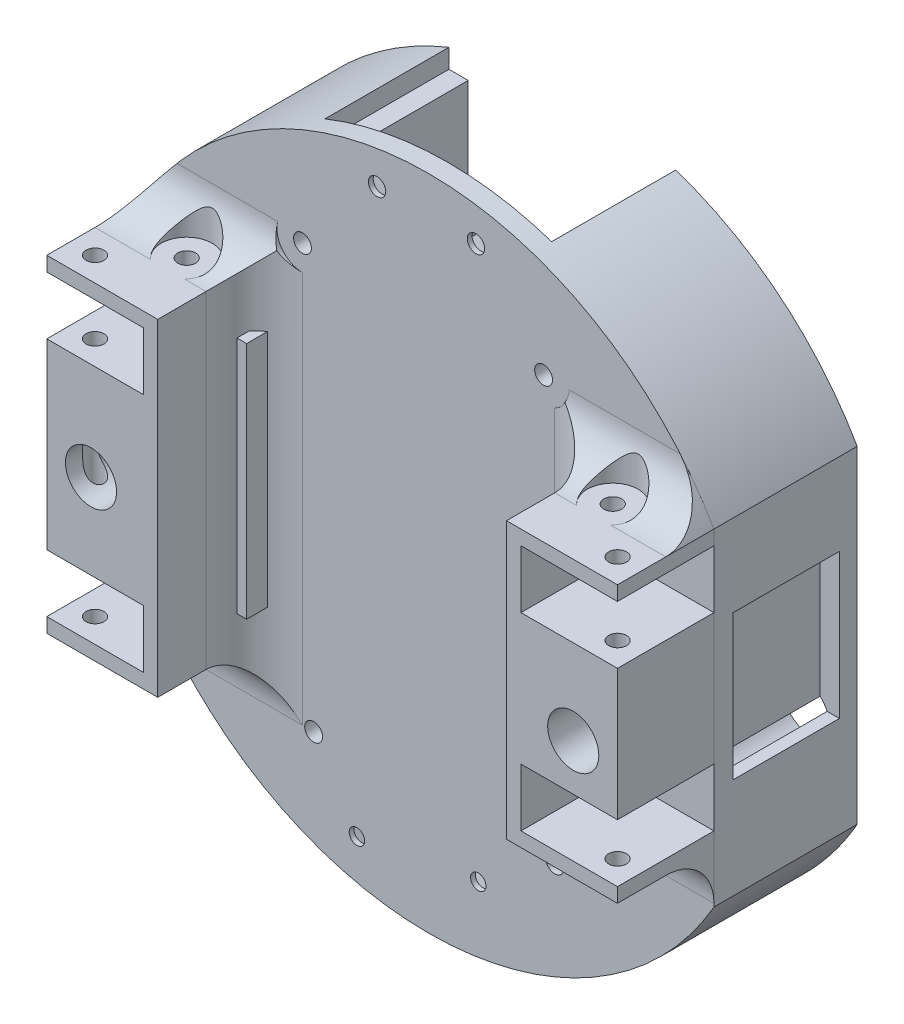
from build123d import *

# Parameters (mm, degrees)
SALIENTE_EXTRUIR2_DEPTH  = 25.7
CROQUIS3_R               = 68.187967498
SALIENTE_EXTRUIR3_DEPTH  = 4
CORTAR_EXTRUIR1_REACH    = 275.509
CROQUIS7_W               = 25
CROQUIS7_H               = 54.5
CORTAR_EXTRUIR2_DEPTH    = 2
CROQUIS8_R               = 1.6
CORTAR_EXTRUIR3_DEPTH    = 10
CROQUIS9_W               = 22
CROQUIS9_H               = 30
CORTAR_EXTRUIR4_DEPTH    = 4
CROQUIS10_R              = 1.85
CORTAR_EXTRUIR5_DEPTH    = 271.994192832
CROQUIS11_W              = 36.494454581
CROQUIS11_H              = 14.83840461
SALIENTE_EXTRUIR4_DEPTH  = 5
CROQUIS12_W              = 36.494454581
CROQUIS12_H              = 7.419202305
SALIENTE_EXTRUIR5_DEPTH  = 60
CROQUIS13_W              = 2.197225814
CROQUIS13_H              = 2.698054226
CORTAR_EXTRUIR6_DEPTH    = 288.011284081
CROQUIS15_W              = 2
CROQUIS15_H              = 49.489125547
SALIENTE_EXTRUIR6_DEPTH  = 6
CROQUIS16_R              = 1.6
CORTAR_EXTRUIR7_DEPTH    = 10
CROQUIS17_R              = 1.85
CORTAR_EXTRUIR8_DEPTH    = 167.163173861
CROQUIS23_W              = 25.422767162
CROQUIS23_H              = 18
CROQUIS23_W_2            = 26.870888419
SALIENTE_EXTRUIR8_DEPTH  = 20
CROQUIS24_W              = 20
CROQUIS24_H              = 12
CROQUIS24_W_2            = 2.422767162
CROQUIS24_H_2            = 18
CROQUIS24_W_3            = 3.870888419
CORTAR_EXTRUIR12_DEPTH   = 20
CROQUIS25_R              = 1.85
CORTAR_EXTRUIR13_DEPTH   = 157.420786096
CROQUIS26_R              = 7
CORTAR_EXTRUIR14_DEPTH   = 23
CORTAR_EXTRUIR15_DEPTH   = 3
CROQUIS28_W              = 15
CROQUIS28_H              = 9
CROQUIS28_W_2            = 18
CROQUIS28_H_2            = 16
CORTAR_EXTRUIR16_DEPTH   = 10
SALIENTE_EXTRUIR9_START  = -7.419202305
CROQUIS29_R              = 1.85
SALIENTE_EXTRUIR9_DEPTH  = 7.419202305
CROQUIS30_W              = 23
CROQUIS30_H              = 31.860199641
CROQUIS30_R              = 5.3
CROQUIS30_H_2            = 21.18941166
SALIENTE_EXTRUIR10_DEPTH = 20
CROQUIS31_R              = 1.85
CORTAR_EXTRUIR17_DEPTH   = 157.420786096
REDONDEO2_R              = 10
CROQUIS32_R              = 5.3
CORTAR_EXTRUIR18_DEPTH   = 278.093418476
CROQUIS33_R              = 5.3
CORTAR_EXTRUIR19_DEPTH   = 10
CORTAR_EXTRUIR21_START   = 10
CROQUIS35_R              = 5.3
CORTAR_EXTRUIR21_DEPTH   = 10
CROQUIS37_R              = 5.3
CORTAR_EXTRUIR23_DEPTH   = 10
CROQUIS38_W              = 4.954639541
CROQUIS38_H              = 9.52618695
SALIENTE_EXTRUIR11_DEPTH = 36.494454581
CROQUIS39_R              = 1.8
CORTAR_EXTRUIR24_DEPTH   = 276.972637799
CORTAR_EXTRUIR25_DEPTH   = 3
CROQUIS45_W              = 36.494454581
CROQUIS45_H              = 24.36459156
CORTAR_EXTRUIR26_DEPTH   = 278.093418476


with BuildPart() as part:
    # Croquis1 → Saliente-Extruir2 (new body)
    with BuildSketch(Plane.XY):
        with BuildLine():
            Line((-13.423815297, -132.294446721), (-13.423815297, -128.345307712))
            ThreePointArc((-13.423815297, -128.345307712), (-26.08823443, -248.103961959), (80.254008279, -191.589802718))
            ThreePointArc((80.254008279, -191.589802718), (67.366727513, -151.697034471), (33.576184703, -126.883445844))
            Line((33.576184703, -126.883445844), (33.576184703, -153.323488747))
            ThreePointArc((33.576184703, -153.323488747), (49.955618696, -169.422778516), (55.963615617, -191.589802718))
            ThreePointArc((55.963615617, -191.589802718), (49.955618696, -213.756826921), (33.576184703, -229.85611669))
            Line((33.576184703, -229.85611669), (33.576184703, -256.294446721))
            Line((33.576184703, -256.294446721), (-9.423815297, -256.294446721))
            Line((-9.423815297, -256.294446721), (-9.423815297, -229.867513756))
            ThreePointArc((-9.423815297, -229.867513756), (-31.831534056, -191.589802718), (-9.423815297, -153.312091681))
            Line((-9.423815297, -153.312091681), (-9.423815297, -132.294446721))
            Line((-9.423815297, -132.294446721), (-13.423815297, -132.294446721))
        make_face()
    extrude(amount=SALIENTE_EXTRUIR2_DEPTH)

    # Croquis3 → Saliente-Extruir3 (add)
    with BuildSketch(Plane.XY.offset(25.7)):
        with Locations(Location((12.066040781, -191.589802718, 0), (0, 0, 111.951246448))):
            Circle(CROQUIS3_R)
    extrude(amount=SALIENTE_EXTRUIR3_DEPTH)

    # Croquis6 → Cortar-Extruir1 (cut, up to next)
    with BuildSketch(Plane.XY.offset(29.7), mode=Mode.PRIVATE) as cortar_extruir1_sk1:
        with BuildLine():
            Line((-47.08078701, -225.519902539), (-47.08078701, -157.659702898))
            ThreePointArc((-47.08078701, -157.659702898), (-56.121926717, -191.589802718), (-47.08078701, -225.519902539))
        make_face()
    cortar_extruir1_tool1 = extrude(cortar_extruir1_sk1.sketch, amount=-CORTAR_EXTRUIR1_REACH, mode=Mode.PRIVATE) & part.part
    # Croquis6 → Cortar-Extruir1 (cut, up to next)
    with BuildSketch(Plane.XY.offset(29.7), mode=Mode.PRIVATE) as cortar_extruir1_sk2:
        with BuildLine():
            ThreePointArc((80.254008279, -191.589802718), (77.954965808, -174.032796418), (71.212868571, -157.659702898))
            Line((71.212868571, -157.659702898), (71.212868571, -225.519902539))
            ThreePointArc((71.212868571, -225.519902539), (77.954965808, -209.146809019), (80.254008279, -191.589802718))
        make_face()
    cortar_extruir1_tool2 = extrude(cortar_extruir1_sk2.sketch, amount=-CORTAR_EXTRUIR1_REACH, mode=Mode.PRIVATE) & part.part
    add(cortar_extruir1_tool1.solids().sort_by_distance((-50.718614, -191.589803, 29.7))[0], mode=Mode.SUBTRACT)
    add(cortar_extruir1_tool2.solids().sort_by_distance((74.850696, -191.589803, 29.7))[0], mode=Mode.SUBTRACT)

    # Croquis7 → Cortar-Extruir2 (cut)
    with BuildSketch(Plane.ZY.offset(47.08078701)):
        with Locations((15.2, -191.909702898)):
            Rectangle(CROQUIS7_W, CROQUIS7_H)
    extrude(amount=-CORTAR_EXTRUIR2_DEPTH, mode=Mode.SUBTRACT)

    # Croquis8 → Cortar-Extruir3 (cut)
    with BuildSketch(Plane.ZY.offset(45.08078701)):
        with Locations((5.7, -209.159702898)):
            Circle(CROQUIS8_R)
        with Locations((24.7, -174.959702898)):
            Circle(CROQUIS8_R)
    extrude(amount=-CORTAR_EXTRUIR3_DEPTH, mode=Mode.SUBTRACT)

    # Croquis9 → Cortar-Extruir4 (cut)
    with BuildSketch(Plane(origin=(71.212868571, 0, 0), x_dir=(0, 0, -1), z_dir=(1, 0, 0))):
        with Locations((-14.7, -189.659702898)):
            Rectangle(CROQUIS9_W, CROQUIS9_H)
    extrude(amount=-CORTAR_EXTRUIR4_DEPTH, mode=Mode.SUBTRACT)

    # Croquis10 → Cortar-Extruir5 (cut, through all)
    with BuildSketch(Plane(origin=(0, 0, 0), x_dir=(-1, 0, 0), z_dir=(0, 0, -1))):
        with Locations((11.768253413, -235.543487664)):
            Circle(CROQUIS10_R)
        with Locations((-38.213901437, -234.207749444)):
            Circle(CROQUIS10_R)
        with Locations((37.916114069, -192.925540938)):
            Circle(CROQUIS10_R)
        with Locations((-62.048195631, -190.254064499)):
            Circle(CROQUIS10_R)
        with Locations((-35.900334975, -147.636117773)):
            Circle(CROQUIS10_R)
        with Locations((14.081819875, -148.971855993)):
            Circle(CROQUIS10_R)
    extrude(amount=-CORTAR_EXTRUIR5_DEPTH, mode=Mode.SUBTRACT)

    # Croquis11 → Saliente-Extruir4 (add)
    with BuildSketch(Plane.XY.offset(29.7)):
        with Locations((11.63234752, -143.283831758)):
            Rectangle(CROQUIS11_W, CROQUIS11_H)
    extrude(amount=SALIENTE_EXTRUIR4_DEPTH)

    # Croquis12 → Saliente-Extruir5 (add)
    with BuildSketch(Plane.XY.offset(34.7)):
        with Locations((11.63234752, -139.574230606)):
            Rectangle(CROQUIS12_W, CROQUIS12_H)
    extrude(amount=SALIENTE_EXTRUIR5_DEPTH)

    # Croquis13 → Cortar-Extruir6 (cut, through all)
    with BuildSketch(Plane(origin=(29.879574811, 0, 0), x_dir=(0, 0, -1), z_dir=(1, 0, 0))):
        with Locations((-66.794067754, -141.934804645)):
            Rectangle(CROQUIS13_W, CROQUIS13_H)
    extrude(amount=-CORTAR_EXTRUIR6_DEPTH, mode=Mode.SUBTRACT)

    # Croquis15 → Saliente-Extruir6 (add)
    with BuildSketch(Plane.XY.offset(29.7)):
        with Locations((-20.658019848, -191.540467922)):
            Rectangle(CROQUIS15_W, CROQUIS15_H)
        with Locations((43.341980152, -191.540467922)):
            Rectangle(CROQUIS15_W, CROQUIS15_H)
    extrude(amount=SALIENTE_EXTRUIR6_DEPTH)

    # Croquis16 → Cortar-Extruir7 (cut)
    with BuildSketch(Plane.XY.offset(29.7)):
        with Locations((-2.795177489, -249.862416258)):
            Circle(CROQUIS16_R)
        with Locations((22.369152578, -245.40207204)):
            Circle(CROQUIS16_R)
    extrude(amount=-CORTAR_EXTRUIR7_DEPTH, mode=Mode.SUBTRACT)

    # Croquis17 → Cortar-Extruir8 (cut, through all)
    with BuildSketch(Plane(origin=(0, -143.283831758, 0), x_dir=(-1, 0, 0), z_dir=(0, -1, 0))):
        with Locations(Location((0.577969088, -88.2, 0), (0, 0, 90))):
            Circle(CROQUIS17_R)
        with Locations(Location((-10.071096588, -88.2, 0), (0, 0, 90))):
            Circle(CROQUIS17_R)
        with Locations(Location((-21.422030912, -88.2, 0), (0, 0, 90))):
            Circle(CROQUIS17_R)
    extrude(amount=-CORTAR_EXTRUIR8_DEPTH, mode=Mode.SUBTRACT)

    # Croquis23 → Saliente-Extruir8 (add)
    with BuildSketch(Plane.XY.offset(29.7)):
        with Locations((-34.369403429, -166.659702898)):
            Rectangle(CROQUIS23_W, CROQUIS23_H)
        with Locations((-34.369403429, -216.519902539)):
            Rectangle(CROQUIS23_W, CROQUIS23_H)
        with Locations((57.777424362, -166.659702898)):
            Rectangle(CROQUIS23_W_2, CROQUIS23_H)
        with Locations((57.777424362, -205.849114558)):
            Rectangle(CROQUIS23_W_2, CROQUIS23_H)
    extrude(amount=SALIENTE_EXTRUIR8_DEPTH)

    # Croquis24 → Cortar-Extruir12 (cut)
    with BuildSketch(Plane.XY.offset(49.7)):
        with Locations((-37.08078701, -166.659702898)):
            Rectangle(CROQUIS24_W, CROQUIS24_H)
        with Locations((-37.08078701, -216.519902539)):
            Rectangle(CROQUIS24_W, CROQUIS24_H)
        with Locations((61.212868571, -166.659702898)):
            Rectangle(CROQUIS24_W, CROQUIS24_H)
        with Locations((61.212868571, -205.849114558)):
            Rectangle(CROQUIS24_W, CROQUIS24_H)
        with Locations((-22.869403429, -166.659702898)):
            Rectangle(CROQUIS24_W_2, CROQUIS24_H_2)
        with Locations((-22.869403429, -216.519902539)):
            Rectangle(CROQUIS24_W_2, CROQUIS24_H_2)
        with Locations((46.277424362, -166.659702898)):
            Rectangle(CROQUIS24_W_3, CROQUIS24_H_2)
        with Locations((46.277424362, -205.849114558)):
            Rectangle(CROQUIS24_W_3, CROQUIS24_H_2)
    extrude(amount=-CORTAR_EXTRUIR12_DEPTH, mode=Mode.SUBTRACT)

    # Croquis25 → Cortar-Extruir13 (cut, through all)
    with BuildSketch(Plane(origin=(0, -157.659702898, 0), x_dir=(1, 0, 0), z_dir=(0, 1, 0))):
        with Locations(Location((-42.08078701, -44.7, 0), (0, 0, 270))):
            Circle(CROQUIS25_R)
        with Locations(Location((-32.08078701, -35.7, 0), (0, 0, 270))):
            Circle(CROQUIS25_R)
        with Locations(Location((66.233156416, -44.7, 0), (0, 0, 270))):
            Circle(CROQUIS25_R)
        with Locations(Location((56.233156416, -35.7, 0), (0, 0, 270))):
            Circle(CROQUIS25_R)
    extrude(amount=-CORTAR_EXTRUIR13_DEPTH, mode=Mode.SUBTRACT)

    # Croquis26 → Cortar-Extruir14 (cut)
    with BuildSketch(Plane(origin=(0, 0, 0), x_dir=(-1, 0, 0), z_dir=(0, 0, -1))):
        with Locations((34.679916564, -216.470406453)):
            Circle(CROQUIS26_R)
        with Locations((34.679916564, -167.641891075)):
            Circle(CROQUIS26_R)
        with Locations(Location((-58.811998126, -167.641891075, 0), (0, 0, 180))):
            Circle(CROQUIS26_R)
        with Locations(Location((-62.399975323, -207.748824541, 0), (0, 0, 133.436969184))):
            Circle(CROQUIS26_R)
    extrude(amount=-CORTAR_EXTRUIR14_DEPTH, mode=Mode.SUBTRACT)

    # Croquis27 → Cortar-Extruir15 (cut)
    with BuildSketch(Plane(origin=(0, 0, 25.7), x_dir=(-1, 0, 0), z_dir=(0, 0, -1))):
        Polygon((-25.714624157, -247.869422828), (-21.905099905, -249.53301081), (-18.559628325, -247.065660022), (-19.023680998, -242.934721252), (-22.83320525, -241.271133271), (-26.17867683, -243.738484058), align=None)
        Polygon((0.321506024, -253.203216983), (4.451560053, -253.67507895), (6.925231518, -250.334278225), (5.268848954, -246.521615533), (1.138794925, -246.049753566), (-1.33487654, -249.390554291), align=None)
    extrude(amount=-CORTAR_EXTRUIR15_DEPTH, mode=Mode.SUBTRACT)

    # Croquis28 → Cortar-Extruir16 (cut)
    with BuildSketch(Plane(origin=(0, -135.864629453, 0), x_dir=(1, 0, 0), z_dir=(0, 1, 0))):
        with Locations((11.379574811, -78.7)):
            Rectangle(CROQUIS28_W, CROQUIS28_H)
        with Locations((12.879574811, -55.7)):
            Rectangle(CROQUIS28_W_2, CROQUIS28_H_2)
    extrude(amount=-CORTAR_EXTRUIR16_DEPTH, mode=Mode.SUBTRACT)

    # Croquis29 → Saliente-Extruir9 (add)
    with BuildSketch(Plane(origin=(0, -135.864629453, 0), x_dir=(1, 0, 0), z_dir=(0, 1, 0)).offset(SALIENTE_EXTRUIR9_START)):
        with Locations((10.071096588, -88.2)):
            Circle(CROQUIS29_R)
    extrude(amount=SALIENTE_EXTRUIR9_DEPTH)

    # Croquis30 → Saliente-Extruir10 (add)
    # profile 1 of 2: a face of its own
    with BuildSketch(Plane.XY.offset(29.7)):
        with Locations((-35.58078701, -191.589802719)):
            Rectangle(CROQUIS30_W, CROQUIS30_H)
        with Locations((-37.916114069, -192.925540938)):
            Circle(CROQUIS30_R, mode=Mode.SUBTRACT)
    # profile 2 of 2: a face of its own
    with BuildSketch(Plane.XY.offset(29.7)):
        with Locations((59.712868571, -186.254408728)):
            Rectangle(CROQUIS30_W, CROQUIS30_H_2)
        with Locations((62.048195631, -190.254064499)):
            Circle(CROQUIS30_R, mode=Mode.SUBTRACT)
    extrude(amount=SALIENTE_EXTRUIR10_DEPTH)

    # Croquis31 → Cortar-Extruir17 (cut, through all)
    with BuildSketch(Plane.XZ.offset(225.519902539)):
        with Locations(Location((-42.08078701, 44.7, 0), (0, 0, 90))):
            Circle(CROQUIS31_R)
        with Locations(Location((-32.08078701, 35.7, 0), (0, 0, 90))):
            Circle(CROQUIS31_R)
        with Locations(Location((56.233156416, 35.7, 0), (0, 0, 90))):
            Circle(CROQUIS31_R)
        with Locations(Location((66.233156416, 44.7, 0), (0, 0, 90))):
            Circle(CROQUIS31_R)
    extrude(amount=-CORTAR_EXTRUIR17_DEPTH, mode=Mode.SUBTRACT)

    # Redondeo2
    # the kernel refuses this fillet: 10 mm, written as the material it adds along each edge
    with BuildSketch(Plane(origin=(-47.08078701, -225.519902539, 29.7), x_dir=(0, -1, 0), z_dir=(1, 0, 0))) as redondeo2_piece_1_section:
        with BuildLine():
            CenterArc((REDONDEO2_R, -REDONDEO2_R), REDONDEO2_R, 90, 90)
            Line((0, -REDONDEO2_R), (0, 0))
            Line((0, 0), (REDONDEO2_R, 0))
        make_face()
    redondeo2_piece_1 = extrude(amount=23, mode=Mode.PRIVATE)
    redondeo2_piece_1 = redondeo2_piece_1 & Plane(origin=(12.066040781, -191.589802718, 31.973355748), x_dir=(-0.3738175078844624, 0.9275022753605783, 0), z_dir=(0, 0, -1)) * Cylinder(68.187967498, 86, mode=Mode.PRIVATE)
    redondeo2_piece_1 = redondeo2_piece_1 - Plane(origin=(-32.08078701, -227.679625959, 35.7), x_dir=(0, 0, 1), z_dir=(0, 1, 0)) * Cylinder(1.85, 86, mode=Mode.PRIVATE)
    add(redondeo2_piece_1)
    with BuildSketch(Plane(origin=(71.212868571, -157.659702898, 29.7), x_dir=(0, 1, 0), z_dir=(-1, 0, 0))) as redondeo2_piece_2_section:
        with BuildLine():
            CenterArc((REDONDEO2_R, -REDONDEO2_R), REDONDEO2_R, 90, 90)
            Line((0, -REDONDEO2_R), (0, 0))
            Line((0, 0), (REDONDEO2_R, 0))
        make_face()
    redondeo2_piece_2 = extrude(amount=23, mode=Mode.PRIVATE)
    redondeo2_piece_2 = redondeo2_piece_2 & Plane(origin=(12.066040781, -191.589802718, 31.973351105), x_dir=(-0.3738175078844624, 0.9275022753605783, 0), z_dir=(0, 0, -1)) * Cylinder(68.187967498, 87, mode=Mode.PRIVATE)
    redondeo2_piece_2 = redondeo2_piece_2 - Plane(origin=(56.233156416, -155.49997883, 35.7), x_dir=(0, 0, 1), z_dir=(0, 1, 0)) * Cylinder(1.85, 87, mode=Mode.PRIVATE)
    add(redondeo2_piece_2)
    with BuildSketch(Plane(origin=(71.212868571, -214.849114558, 29.7), x_dir=(0, -1, 0), z_dir=(-1, 0, 0))) as redondeo2_piece_3_section:
        with BuildLine():
            CenterArc((REDONDEO2_R, REDONDEO2_R), REDONDEO2_R, 180, 90)
            Line((0, REDONDEO2_R), (0, 0))
            Line((0, 0), (REDONDEO2_R, 0))
        make_face()
    redondeo2_piece_3 = extrude(amount=23, mode=Mode.PRIVATE)
    redondeo2_piece_3 = redondeo2_piece_3 - Plane(origin=(56.233156416, -217.15062126, 35.7), x_dir=(0, 0, 1), z_dir=(0, 1, 0)) * Cylinder(1.85, 87, mode=Mode.PRIVATE)
    add(redondeo2_piece_3)
    with BuildSketch(Plane(origin=(-47.08078701, -157.659702898, 29.7), x_dir=(0, 1, 0), z_dir=(1, 0, 0))) as redondeo2_piece_4_section:
        with BuildLine():
            CenterArc((REDONDEO2_R, REDONDEO2_R), REDONDEO2_R, 180, 90)
            Line((0, REDONDEO2_R), (0, 0))
            Line((0, 0), (REDONDEO2_R, 0))
        make_face()
    redondeo2_piece_4 = extrude(amount=23, mode=Mode.PRIVATE)
    redondeo2_piece_4 = redondeo2_piece_4 & Plane(origin=(12.066040781, -191.589802718, 31.973356861), x_dir=(-0.3738175078844624, 0.9275022753605783, 0), z_dir=(0, 0, -1)) * Cylinder(68.187967498, 86, mode=Mode.PRIVATE)
    redondeo2_piece_4 = redondeo2_piece_4 - Plane(origin=(-32.08078701, -155.49997901, 35.7), x_dir=(0, 0, 1), z_dir=(0, 1, 0)) * Cylinder(1.85, 86, mode=Mode.PRIVATE)
    add(redondeo2_piece_4)
    with BuildSketch(Plane(origin=(-24.08078701, -157.659702898, 29.7), x_dir=(1, 0, 0), z_dir=(0, -1, 0))) as redondeo2_piece_5:
        with BuildLine():
            CenterArc((REDONDEO2_R, REDONDEO2_R), REDONDEO2_R, 180, 90)
            Line((0, REDONDEO2_R), (0, 0))
            Line((0, 0), (REDONDEO2_R, 0))
        make_face()
    extrude(amount=67.86019964)
    with BuildSketch(Plane(origin=(48.212868571, -214.849114558, 29.7), x_dir=(-1, 0, 0), z_dir=(0, 1, 0))) as redondeo2_piece_6:
        with BuildLine():
            CenterArc((REDONDEO2_R, REDONDEO2_R), REDONDEO2_R, 180, 90)
            Line((0, REDONDEO2_R), (0, 0))
            Line((0, 0), (REDONDEO2_R, 0))
        make_face()
    extrude(amount=57.18941166)
    with BuildSketch(Plane(origin=(-24.08078701, -157.659702898, 29.7), x_dir=(1, 0, 0), z_dir=(0, -1, 0))) as redondeo2_piece_7a_section:
        with BuildLine():
            CenterArc((REDONDEO2_R, REDONDEO2_R), REDONDEO2_R, 180, 90)
            Line((0, REDONDEO2_R), (0, 0))
            Line((0, 0), (REDONDEO2_R, 0))
        make_face()
    redondeo2_piece_7a = extrude(amount=92.86019964, mode=Mode.PRIVATE)
    redondeo2_piece_7a = redondeo2_piece_7a & Plane(origin=(12.066040781, -191.589802718, 31.940610005), x_dir=(-0.3738175078844624, 0.9275022753605783, 0), z_dir=(0, 0, -1)) * Cylinder(68.187967498, 226, mode=Mode.PRIVATE)
    redondeo2_piece_7a = split(redondeo2_piece_7a, bisect_by=Plane(origin=(-21.788201619, -225.519902539, 31.940610005), z_dir=(0, -1, 0)), keep=Keep.TOP, mode=Mode.PRIVATE)
    with BuildSketch(Plane(origin=(-47.08078701, -225.519902539, 29.7), x_dir=(0, -1, 0), z_dir=(1, 0, 0))) as redondeo2_piece_7b_section:
        with BuildLine():
            CenterArc((REDONDEO2_R, -REDONDEO2_R), REDONDEO2_R, 90, 90)
            Line((0, -REDONDEO2_R), (0, 0))
            Line((0, 0), (REDONDEO2_R, 0))
        make_face()
    redondeo2_piece_7b = extrude(amount=48, mode=Mode.PRIVATE)
    redondeo2_piece_7b = redondeo2_piece_7b - Plane(origin=(-11.768253413, -235.543487664, 31.968653501), x_dir=(-1, 0, 0), z_dir=(0, 0, -1)) * Cylinder(1.85, 136, mode=Mode.PRIVATE)
    redondeo2_piece_7b = split(redondeo2_piece_7b, bisect_by=Plane(origin=(-24.08078701, -227.77002234, 31.968653501), z_dir=(1, 0, 0)), keep=Keep.TOP, mode=Mode.PRIVATE)
    redondeo2_piece_7 = redondeo2_piece_7a & redondeo2_piece_7b
    add(redondeo2_piece_7)
    with BuildSketch(Plane(origin=(71.212868571, -157.659702898, 29.7), x_dir=(0, 1, 0), z_dir=(-1, 0, 0))) as redondeo2_piece_8a_section:
        with BuildLine():
            CenterArc((REDONDEO2_R, -REDONDEO2_R), REDONDEO2_R, 90, 90)
            Line((0, -REDONDEO2_R), (0, 0))
            Line((0, 0), (REDONDEO2_R, 0))
        make_face()
    redondeo2_piece_8a = extrude(amount=48, mode=Mode.PRIVATE)
    redondeo2_piece_8a = redondeo2_piece_8a - Plane(origin=(35.900334975, -147.636117773, 31.968653501), x_dir=(-1, 0, 0), z_dir=(0, 0, -1)) * Cylinder(1.85, 137, mode=Mode.PRIVATE)
    redondeo2_piece_8a = split(redondeo2_piece_8a, bisect_by=Plane(origin=(48.212868571, -155.409583097, 31.968653501), z_dir=(-1, 0, 0)), keep=Keep.TOP, mode=Mode.PRIVATE)
    with BuildSketch(Plane(origin=(48.212868571, -214.849114558, 29.7), x_dir=(-1, 0, 0), z_dir=(0, 1, 0))) as redondeo2_piece_8b_section:
        with BuildLine():
            CenterArc((REDONDEO2_R, REDONDEO2_R), REDONDEO2_R, 180, 90)
            Line((0, REDONDEO2_R), (0, 0))
            Line((0, 0), (REDONDEO2_R, 0))
        make_face()
    redondeo2_piece_8b = extrude(amount=82.18941166, mode=Mode.PRIVATE)
    redondeo2_piece_8b = redondeo2_piece_8b & Plane(origin=(12.066040781, -191.589802718, 31.940610005), x_dir=(-0.3738175078844624, 0.9275022753605783, 0), z_dir=(0, 0, -1)) * Cylinder(68.187967498, 205, mode=Mode.PRIVATE)
    redondeo2_piece_8b = split(redondeo2_piece_8b, bisect_by=Plane(origin=(45.920283181, -157.659702898, 31.940610005), z_dir=(0, 1, 0)), keep=Keep.TOP, mode=Mode.PRIVATE)
    redondeo2_piece_8 = redondeo2_piece_8a & redondeo2_piece_8b
    add(redondeo2_piece_8)
    with BuildSketch(Plane(origin=(71.212868571, -214.849114558, 29.7), x_dir=(0, -1, 0), z_dir=(-1, 0, 0))) as redondeo2_piece_9a_section:
        with BuildLine():
            CenterArc((REDONDEO2_R, REDONDEO2_R), REDONDEO2_R, 180, 90)
            Line((0, REDONDEO2_R), (0, 0))
            Line((0, 0), (REDONDEO2_R, 0))
        make_face()
    redondeo2_piece_9a = extrude(amount=48, mode=Mode.PRIVATE)
    redondeo2_piece_9a = split(redondeo2_piece_9a, bisect_by=Plane(origin=(48.212868571, -217.113065701, 31.963951143), z_dir=(-1, 0, 0)), keep=Keep.TOP, mode=Mode.PRIVATE)
    with BuildSketch(Plane(origin=(48.212868571, -239.849114558, 29.7), x_dir=(-1, 0, 0), z_dir=(0, 1, 0))) as redondeo2_piece_9b_section:
        with BuildLine():
            CenterArc((REDONDEO2_R, REDONDEO2_R), REDONDEO2_R, 180, 90)
            Line((0, REDONDEO2_R), (0, 0))
            Line((0, 0), (REDONDEO2_R, 0))
        make_face()
    redondeo2_piece_9b = extrude(amount=82.18941166, mode=Mode.PRIVATE)
    redondeo2_piece_9b = redondeo2_piece_9b - Plane(origin=(38.213901437, -234.207749444, 31.968757172), x_dir=(-1, 0, 0), z_dir=(0, 0, -1)) * Cylinder(1.85, 205, mode=Mode.PRIVATE)
    redondeo2_piece_9b = split(redondeo2_piece_9b, bisect_by=Plane(origin=(45.963029378, -214.849114558, 31.968757172), z_dir=(0, -1, 0)), keep=Keep.TOP, mode=Mode.PRIVATE)
    redondeo2_piece_9 = redondeo2_piece_9a & redondeo2_piece_9b
    add(redondeo2_piece_9)
    with BuildSketch(Plane(origin=(-47.08078701, -157.659702898, 29.7), x_dir=(0, 1, 0), z_dir=(1, 0, 0))) as redondeo2_piece_10a_section:
        with BuildLine():
            CenterArc((REDONDEO2_R, REDONDEO2_R), REDONDEO2_R, 180, 90)
            Line((0, REDONDEO2_R), (0, 0))
            Line((0, 0), (REDONDEO2_R, 0))
        make_face()
    redondeo2_piece_10a = extrude(amount=48, mode=Mode.PRIVATE)
    redondeo2_piece_10a = redondeo2_piece_10a - Plane(origin=(-14.081819875, -148.971855993, 31.97595745), x_dir=(-1, 0, 0), z_dir=(0, 0, -1)) * Cylinder(1.85, 136, mode=Mode.PRIVATE)
    redondeo2_piece_10a = split(redondeo2_piece_10a, bisect_by=Plane(origin=(-24.08078701, -155.427355558, 31.97595745), z_dir=(1, 0, 0)), keep=Keep.TOP, mode=Mode.PRIVATE)
    with BuildSketch(Plane(origin=(-24.08078701, -132.659702898, 29.7), x_dir=(1, 0, 0), z_dir=(0, -1, 0))) as redondeo2_piece_10b_section:
        with BuildLine():
            CenterArc((REDONDEO2_R, REDONDEO2_R), REDONDEO2_R, 180, 90)
            Line((0, REDONDEO2_R), (0, 0))
            Line((0, 0), (REDONDEO2_R, 0))
        make_face()
    redondeo2_piece_10b = extrude(amount=92.86019964, mode=Mode.PRIVATE)
    redondeo2_piece_10b = redondeo2_piece_10b & Plane(origin=(12.066040781, -191.589802718, 31.945440695), x_dir=(-0.3738175078844624, 0.9275022753605783, 0), z_dir=(0, 0, -1)) * Cylinder(68.187967498, 226, mode=Mode.PRIVATE)
    redondeo2_piece_10b = redondeo2_piece_10b - Plane(origin=(-14.081819875, -148.971855993, 31.945440695), x_dir=(-1, 0, 0), z_dir=(0, 0, -1)) * Cylinder(1.85, 226, mode=Mode.PRIVATE)
    redondeo2_piece_10b = split(redondeo2_piece_10b, bisect_by=Plane(origin=(-21.802469491, -157.659702898, 31.945440695), z_dir=(0, 1, 0)), keep=Keep.TOP, mode=Mode.PRIVATE)
    redondeo2_piece_10 = redondeo2_piece_10a & redondeo2_piece_10b
    add(redondeo2_piece_10)

    # Croquis32 → Cortar-Extruir18 (cut, through all)
    with BuildSketch(Plane.XY.offset(29.7)):
        with Locations((-14.081819875, -148.971855993)):
            Circle(CROQUIS32_R)
        with Locations((35.900334975, -147.636117773)):
            Circle(CROQUIS32_R)
    extrude(amount=CORTAR_EXTRUIR18_DEPTH, mode=Mode.SUBTRACT)

    # Croquis33 → Cortar-Extruir19 (cut)
    with BuildSketch(Plane.XZ.offset(225.519902539)):
        with Locations((-32.08078701, 35.7)):
            Circle(CROQUIS33_R)
        with Locations((56.233156416, 35.7)):
            Circle(CROQUIS33_R)
    extrude(amount=CORTAR_EXTRUIR19_DEPTH, mode=Mode.SUBTRACT)

    # Croquis35 → Cortar-Extruir21 (cut)
    with BuildSketch(Plane(origin=(0, -157.659702898, 0), x_dir=(1, 0, 0), z_dir=(0, 1, 0)).offset(CORTAR_EXTRUIR21_START)):
        with Locations((-32.08078701, -35.7)):
            Circle(CROQUIS35_R)
        with Locations((56.233156416, -35.7)):
            Circle(CROQUIS35_R)
    extrude(amount=-CORTAR_EXTRUIR21_DEPTH, mode=Mode.SUBTRACT)

    # Croquis37 → Cortar-Extruir23 (cut)
    with BuildSketch(Plane.XZ.offset(214.849114558)):
        with Locations((56.233156416, 35.7)):
            Circle(CROQUIS37_R)
    extrude(amount=CORTAR_EXTRUIR23_DEPTH, mode=Mode.SUBTRACT)

    # Croquis38 → Saliente-Extruir11 (add)
    with BuildSketch(Plane.ZY.offset(6.61487977)):
        with Locations((32.179910053, -131.101535978)):
            Rectangle(CROQUIS38_W, CROQUIS38_H)
    extrude(amount=-SALIENTE_EXTRUIR11_DEPTH)

    # Croquis39 → Cortar-Extruir24 (cut, through all)
    with BuildSketch(Plane.XY.offset(34.657229823)):
        with Locations((1.38512023, -131.101535978)):
            Circle(CROQUIS39_R)
        with Locations((21.879574811, -131.101535978)):
            Circle(CROQUIS39_R)
    extrude(amount=-CORTAR_EXTRUIR24_DEPTH, mode=Mode.SUBTRACT)

    # Croquis40 → Cortar-Extruir25 (cut)
    with BuildSketch(Plane(origin=(0, 0, 25.7), x_dir=(-1, 0, 0), z_dir=(0, 0, -1))):
        Polygon((-18.52315598, -132.780162192), (-18.747632451, -129.034105112), (-22.104051281, -127.355478898), (-25.235993642, -129.422909764), (-25.011517171, -133.168966844), (-21.655098341, -134.847593058), align=None)
        Polygon((-0.464161648, -134.739553106), (2.225974313, -132.122971014), (1.305015732, -128.484953886), (-2.306078811, -127.46351885), (-4.996214773, -130.080100941), (-4.075256191, -133.718118069), align=None)
    extrude(amount=-CORTAR_EXTRUIR25_DEPTH, mode=Mode.SUBTRACT)


with BuildPart() as body_2:
    # Partir1: the piece on the far side of the plane
    add(part.part)
    split(bisect_by=Plane.XY.offset(29.7), keep=Keep.BOTTOM)


with BuildPart() as part_1:
    add(part.part)

    # Partir1
    split(bisect_by=Plane.XY.offset(29.7), keep=Keep.TOP)

    # Croquis45 → Cortar-Extruir26 (cut, through all)
    with BuildSketch(Plane.XY.offset(29.7)):
        with Locations((11.63234752, -138.520738283)):
            Rectangle(CROQUIS45_W, CROQUIS45_H)
    extrude(amount=CORTAR_EXTRUIR26_DEPTH, mode=Mode.SUBTRACT)


solid = Compound([body_2.part, part_1.part])
